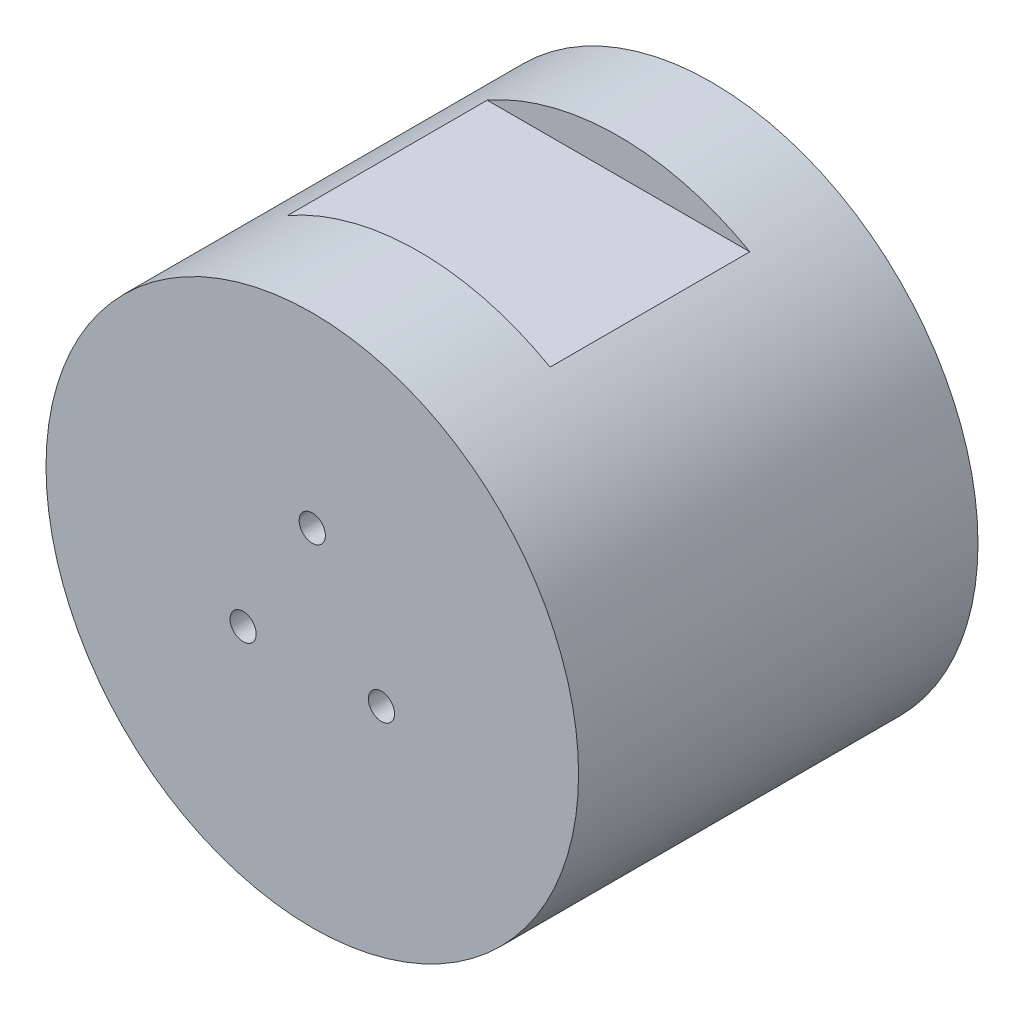
from build123d import *

# Parameters (mm, degrees)
SKETCH1_R                      = 25.4
BOSS_EXTRUDE1_DEPTH            = 38.1
SKETCH2_R                      = 17.67586
CUT_EXTRUDE1_DEPTH             = 31.75
CUT_EXTRUDE3_REACH             = 54.363
SKETCH6_W                      = 19.05
SKETCH6_H                      = 3.302
CUT_EXTRUDE3_DIRECTION_2_REACH = 54.363
CUT_EXTRUDE4_REACH             = 49.941
SKETCH7_R                      = 1.25


with BuildPart() as part:
    # Sketch1 → Boss-Extrude1 (new body)
    with BuildSketch(Plane.XY):
        Circle(SKETCH1_R)
    extrude(amount=BOSS_EXTRUDE1_DEPTH)

    # Sketch2 → Cut-Extrude1 (cut)
    with BuildSketch(Plane(origin=(0, 0, 0), x_dir=(-1, 0, 0), z_dir=(0, 0, -1))):
        Circle(SKETCH2_R)
    extrude(amount=-CUT_EXTRUDE1_DEPTH, mode=Mode.SUBTRACT)

    # Sketch6 → Cut-Extrude3 (cut, up to next)
    with BuildSketch(Plane(origin=(0, 0, 0), x_dir=(0, 0, -1), z_dir=(1, 0, 0)), mode=Mode.PRIVATE) as cut_extrude3_sk1:
        with Locations((-18.415, 23.749)):
            Rectangle(SKETCH6_W, SKETCH6_H)
    cut_extrude3_tool1 = extrude(cut_extrude3_sk1.sketch, amount=-CUT_EXTRUDE3_REACH, mode=Mode.PRIVATE) & part.part
    # Sketch6 → Cut-Extrude3 (cut, up to next)
    with BuildSketch(Plane(origin=(0, 0, 0), x_dir=(0, 0, -1), z_dir=(1, 0, 0)), mode=Mode.PRIVATE) as cut_extrude3_sk2:
        with Locations((-18.415, -23.749)):
            Rectangle(SKETCH6_W, SKETCH6_H)
    cut_extrude3_tool2 = extrude(cut_extrude3_sk2.sketch, amount=-CUT_EXTRUDE3_REACH, mode=Mode.PRIVATE) & part.part
    add(cut_extrude3_tool1.solids().sort_by_distance((0, 23.749, 18.415))[0], mode=Mode.SUBTRACT)
    add(cut_extrude3_tool2.solids().sort_by_distance((0, -23.749, 18.415))[0], mode=Mode.SUBTRACT)

    # Sketch6 → Cut-Extrude3 direction 2 (cut, up to next)
    with BuildSketch(Plane(origin=(0, 0, 0), x_dir=(0, 0, -1), z_dir=(1, 0, 0)), mode=Mode.PRIVATE) as cut_extrude3_direction_2_sk1:
        with Locations((-18.415, 23.749)):
            Rectangle(SKETCH6_W, SKETCH6_H)
    cut_extrude3_direction_2_tool1 = extrude(cut_extrude3_direction_2_sk1.sketch, amount=CUT_EXTRUDE3_DIRECTION_2_REACH, mode=Mode.PRIVATE) & part.part
    # Sketch6 → Cut-Extrude3 direction 2 (cut, up to next)
    with BuildSketch(Plane(origin=(0, 0, 0), x_dir=(0, 0, -1), z_dir=(1, 0, 0)), mode=Mode.PRIVATE) as cut_extrude3_direction_2_sk2:
        with Locations((-18.415, -23.749)):
            Rectangle(SKETCH6_W, SKETCH6_H)
    cut_extrude3_direction_2_tool2 = extrude(cut_extrude3_direction_2_sk2.sketch, amount=CUT_EXTRUDE3_DIRECTION_2_REACH, mode=Mode.PRIVATE) & part.part
    add(cut_extrude3_direction_2_tool1.solids().sort_by_distance((0, 23.749, 18.415))[0], mode=Mode.SUBTRACT)
    add(cut_extrude3_direction_2_tool2.solids().sort_by_distance((0, -23.749, 18.415))[0], mode=Mode.SUBTRACT)

    # Sketch7 → Cut-Extrude4 (cut, up to next)
    with BuildSketch(Plane(origin=(0, 0, 31.75), x_dir=(-1, 0, 0), z_dir=(0, 0, -1)), mode=Mode.PRIVATE) as cut_extrude4_sk1:
        with Locations((0, 7.62)):
            Circle(SKETCH7_R)
    cut_extrude4_tool1 = extrude(cut_extrude4_sk1.sketch, amount=-CUT_EXTRUDE4_REACH, mode=Mode.PRIVATE) & part.part
    # Sketch7 → Cut-Extrude4 (cut, up to next)
    with BuildSketch(Plane(origin=(0, 0, 31.75), x_dir=(-1, 0, 0), z_dir=(0, 0, -1)), mode=Mode.PRIVATE) as cut_extrude4_sk2:
        with Locations((6.599113577, -3.81)):
            Circle(SKETCH7_R)
    cut_extrude4_tool2 = extrude(cut_extrude4_sk2.sketch, amount=-CUT_EXTRUDE4_REACH, mode=Mode.PRIVATE) & part.part
    # Sketch7 → Cut-Extrude4 (cut, up to next)
    with BuildSketch(Plane(origin=(0, 0, 31.75), x_dir=(-1, 0, 0), z_dir=(0, 0, -1)), mode=Mode.PRIVATE) as cut_extrude4_sk3:
        with Locations((-6.599113577, -3.81)):
            Circle(SKETCH7_R)
    cut_extrude4_tool3 = extrude(cut_extrude4_sk3.sketch, amount=-CUT_EXTRUDE4_REACH, mode=Mode.PRIVATE) & part.part
    add(cut_extrude4_tool1.solids().sort_by_distance((0, 7.62, 31.75))[0], mode=Mode.SUBTRACT)
    add(cut_extrude4_tool2.solids().sort_by_distance((-6.599114, -3.81, 31.75))[0], mode=Mode.SUBTRACT)
    add(cut_extrude4_tool3.solids().sort_by_distance((6.599114, -3.81, 31.75))[0], mode=Mode.SUBTRACT)


solid = part.part
